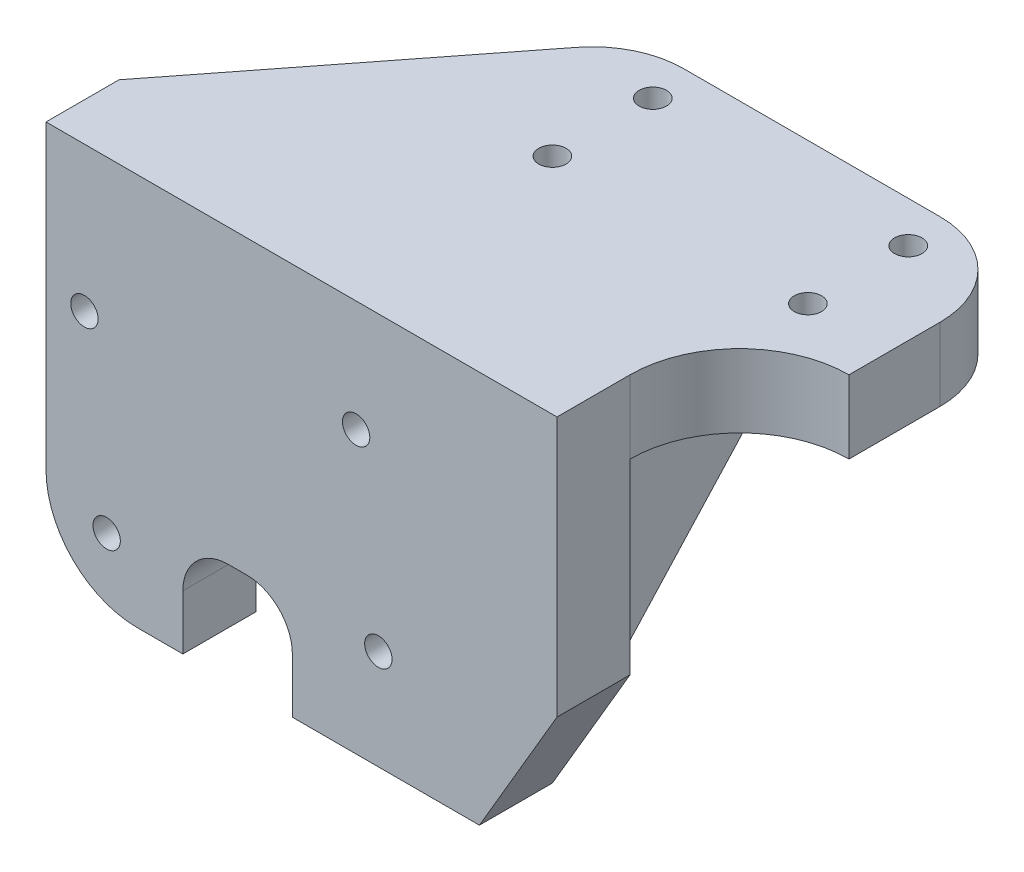
from build123d import *

# Parameters (mm, degrees)
SKETCH_1_W                = 90
SKETCH_1_H                = 40
EXTRUDE_1_DEPTH           = 8
SKETCH_2_R                = 1.5
CUT_EXTRUDE_1_DEPTH       = 50.889878733
SKETCH_3_W                = 90
SKETCH_3_H                = 8
EXTRUDE_2_DEPTH           = 35
CUT_EXTRUDE_3_DEPTH       = 61.415229868
SKETCH_7_W                = 22
SKETCH_7_H                = 40
CUT_EXTRUDE_4_DEPTH       = 66.375836515
SKETCH_8_W                = 5
SKETCH_8_H                = 32
EXTRUDE_3_DEPTH           = 35
CUT_EXTRUDE_5_DEPTH       = 59.576872569
SKETCH_14_R               = 1.5
CUT_EXTRUDE_8_DEPTH       = 70.641941386
SKETCH_15_W               = 12
SKETCH_15_H               = 11
CUT_EXTRUDE_10_DEPTH      = 70.641941386
FILLET_2_R                = 5
FILLET_5_R                = 5
CUT_EXTRUDE_11_DEPTH      = 66.375836515
CUT_EXTRUDE_11_DEPTH_BACK = 66.375836515
FILLET_4_R                = 10
CUT_EXTRUDE_12_DEPTH      = 66.375836515
SKETCH_19_W               = 6
SKETCH_19_H               = 20
EXTRUDE_4_DEPTH           = 20
CUT_EXTRUDE_13_REACH      = 67.008
FILLET_6_R                = 3


with BuildPart() as part:
    # 草图1 → 凸台-拉伸1 (new body)
    with BuildSketch(Plane(origin=(0, 0, 0), x_dir=(1, 0, 0), z_dir=(0, 1, 0))):
        Rectangle(SKETCH_1_W, SKETCH_1_H)
    extrude(amount=EXTRUDE_1_DEPTH)

    # 草图2 → 切除-拉伸1 (cut, through all)
    with BuildSketch(Plane.XZ):
        with Locations(Location((-14, -4.5, 0), (0, 0, 270))):
            Circle(SKETCH_2_R)
        with Locations(Location((-14, -15.5, 0), (0, 0, 270))):
            Circle(SKETCH_2_R)
        with Locations(Location((14, -15.5, 0), (0, 0, 90))):
            Circle(SKETCH_2_R)
        with Locations(Location((14, -4.5, 0), (0, 0, 90))):
            Circle(SKETCH_2_R)
    extrude(amount=-CUT_EXTRUDE_1_DEPTH, mode=Mode.SUBTRACT)

    # 草图3 → 凸台-拉伸2 (add)
    with BuildSketch(Plane.XZ):
        with Locations((0, 16)):
            Rectangle(SKETCH_3_W, SKETCH_3_H)
    extrude(amount=EXTRUDE_2_DEPTH)

    # 草图6 → 切除-拉伸3 (cut, through all)
    with BuildSketch(Plane.XZ):
        Polygon((-45, 12), (-20, -20), (-45, -20), align=None)
    extrude(amount=-CUT_EXTRUDE_3_DEPTH, mode=Mode.SUBTRACT)

    # 草图7 → 切除-拉伸4 (cut, through all)
    with BuildSketch(Plane(origin=(0, 8, 0), x_dir=(1, 0, 0), z_dir=(0, 1, 0))):
        with Locations((34, 0)):
            Rectangle(SKETCH_7_W, SKETCH_7_H)
    extrude(amount=-CUT_EXTRUDE_4_DEPTH, mode=Mode.SUBTRACT)

    # 草图8 → 凸台-拉伸3 (add)
    with BuildSketch(Plane.XZ):
        with Locations((0, -4)):
            Rectangle(SKETCH_8_W, SKETCH_8_H)
    extrude(amount=EXTRUDE_3_DEPTH)

    # 草图9 → 切除-拉伸5 (cut, through all)
    with BuildSketch(Plane.ZY.offset(2.5)):
        Polygon((-20, 0), (12, -35), (-20, -35), align=None)
    extrude(amount=-CUT_EXTRUDE_5_DEPTH, mode=Mode.SUBTRACT)

    # 草图14 → 切除-拉伸8 (cut, through all)
    with BuildSketch(Plane.XY.offset(20)):
        with Locations((-8.576116211, -24.051679616)):
            Circle(SKETCH_14_R)
        with Locations((-38.352500761, -27.707759918)):
            Circle(SKETCH_14_R)
        with Locations((-40.789887629, -7.856836885)):
            Circle(SKETCH_14_R)
        with Locations((-11.013503079, -4.200756583)):
            Circle(SKETCH_14_R)
    extrude(amount=-CUT_EXTRUDE_8_DEPTH, mode=Mode.SUBTRACT)

    # 草图15 → 切除-拉伸10 (cut, through all)
    with BuildSketch(Plane.XY.offset(20)):
        with Locations((-24, -29.5)):
            Rectangle(SKETCH_15_W, SKETCH_15_H)
    extrude(amount=-CUT_EXTRUDE_10_DEPTH, mode=Mode.SUBTRACT)

    # 圆角2
    fillet_2_edges = [part.edges().sort_by_distance(p)[0] for p in [
        (-30, -24, 16),
        (-18, -24, 16),
    ]]
    fillet(fillet_2_edges, radius=FILLET_2_R)

    # 圆角5
    fillet_5_edges = [part.edges().sort_by_distance(p)[0] for p in [
        (2.5, 0, -4),
        (-2.5, 0, -4),
    ]]
    fillet(fillet_5_edges, radius=FILLET_5_R)

    # 草图16 → 切除-拉伸11 (cut, two sides: drawn at the far end of the back side and taken through both)
    with BuildSketch(Plane(origin=(0, 0, 12), x_dir=(-1, 0, 0), z_dir=(0, 0, -1)).offset(-CUT_EXTRUDE_11_DEPTH_BACK)):
        Polygon((-23, 0), (-2.5, -35), (-23, -35), align=None)
    extrude(amount=CUT_EXTRUDE_11_DEPTH + CUT_EXTRUDE_11_DEPTH_BACK, mode=Mode.SUBTRACT)

    # 圆角4
    fillet_4_edges = [part.edges().sort_by_distance(p)[0] for p in [
        (-45, -35, 16),
        (-20, 4, -20),
        (23, 4, -20),
    ]]
    fillet(fillet_4_edges, radius=FILLET_4_R)

    # 草图18 → 切除-拉伸12 (cut, through all)
    with BuildSketch(Plane(origin=(0, 8, 0), x_dir=(1, 0, 0), z_dir=(0, 1, 0))):
        with BuildLine():
            Line((11, -12), (11, -20))
            Line((11, -20), (23, -20))
            Line((23, -20), (23, -12))
            Line((23, -12), (23, 0))
            ThreePointArc((23, 0), (14.514718626, -3.514718626), (11, -12))
        make_face()
    extrude(amount=-CUT_EXTRUDE_12_DEPTH, mode=Mode.SUBTRACT)

    # 草图19 → 凸台-拉伸4 (add)
    with BuildSketch(Plane(origin=(0, 0, 12), x_dir=(-1, 0, 0), z_dir=(0, 0, -1))):
        with Locations((25, -10)):
            Rectangle(SKETCH_19_W, SKETCH_19_H)
    extrude(amount=EXTRUDE_4_DEPTH)

    # 草图20 → 切除-拉伸13 (cut, up to next)
    with BuildSketch(Plane.ZY.offset(28), mode=Mode.PRIVATE) as cut_extrude_13_sk1:
        Polygon((-8, 0), (12, -20), (-8, -20), align=None)
    cut_extrude_13_tool1 = extrude(cut_extrude_13_sk1.sketch, amount=-CUT_EXTRUDE_13_REACH, mode=Mode.PRIVATE) & part.part
    add(cut_extrude_13_tool1.solids().sort_by_distance((-28, -13.333333, -1.333333))[0], mode=Mode.SUBTRACT)

    # 圆角6
    # the kernel refuses this fillet: 3 mm, written as the material it adds along each edge
    with BuildSketch(Plane(origin=(-22, 0, 19.5), x_dir=(1, 0, 0), z_dir=(0, 0, -1))) as fillet_6_piece_1_section:
        with BuildLine():
            CenterArc((FILLET_6_R, FILLET_6_R), FILLET_6_R, 180, 90)
            Line((0, FILLET_6_R), (0, 0))
            Line((0, 0), (FILLET_6_R, 0))
        make_face()
    fillet_6_piece_1 = extrude(amount=35, mode=Mode.PRIVATE)
    fillet_6_piece_1 = split(fillet_6_piece_1, bisect_by=Plane(origin=(-21.320814657, -12.214592671, 4.214592671), z_dir=(0, 0.7071067811865476, 0.7071067811865476)), keep=Keep.TOP, mode=Mode.PRIVATE)
    add(fillet_6_piece_1)
    with BuildSketch(Plane(origin=(-28, 0, 19.5), x_dir=(-1, 0, 0), z_dir=(0, 0, -1))) as fillet_6_piece_2_section:
        with BuildLine():
            CenterArc((FILLET_6_R, -FILLET_6_R), FILLET_6_R, 90, 90)
            Line((0, -FILLET_6_R), (0, 0))
            Line((0, 0), (FILLET_6_R, 0))
        make_face()
    fillet_6_piece_2 = extrude(amount=35, mode=Mode.PRIVATE)
    fillet_6_piece_2 = split(fillet_6_piece_2, bisect_by=Plane(origin=(-28.679185343, -12.214592671, 4.214592671), z_dir=(0, 0.7071067811865476, 0.7071067811865476)), keep=Keep.TOP, mode=Mode.PRIVATE)
    fillet_6_piece_2 = split(fillet_6_piece_2, bisect_by=Plane(origin=(-40.633408635, -0.679185343, 6.410763053), z_dir=(0.7880243737245634, 0, 0.6156440419723153)), keep=Keep.TOP, mode=Mode.PRIVATE)
    add(fillet_6_piece_2)


solid = part.part
